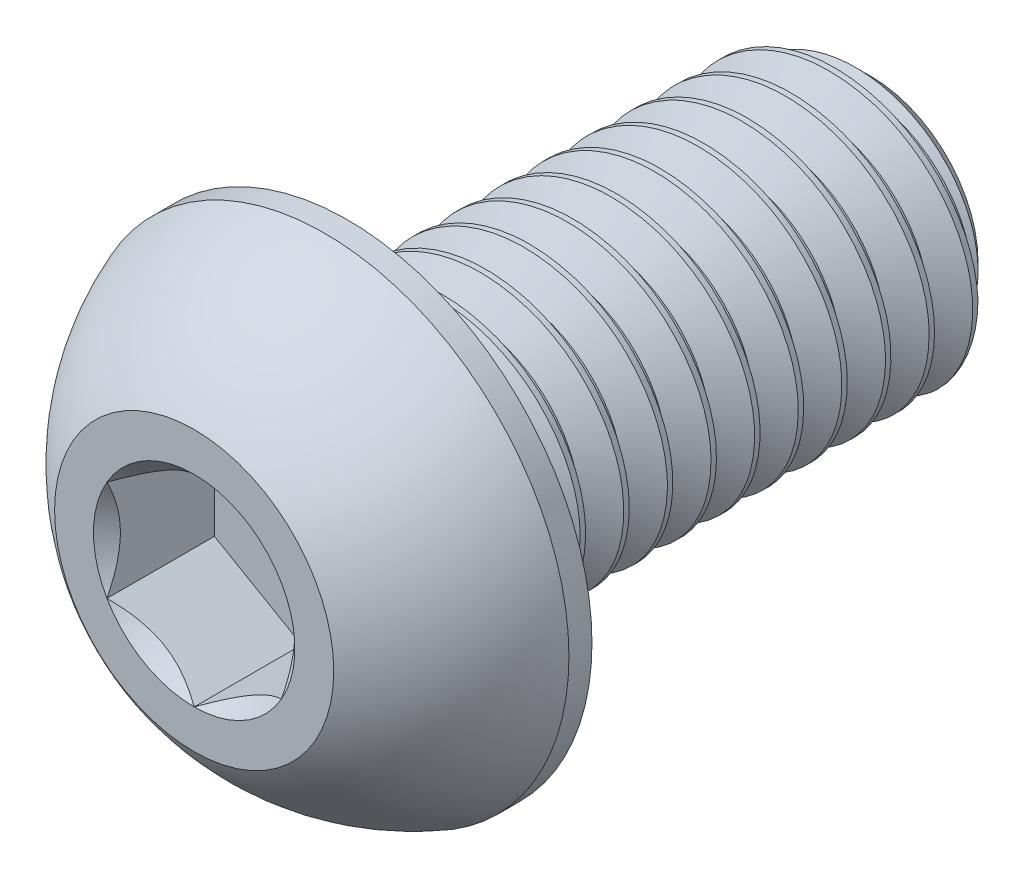
from build123d import *

# Parameters (mm, degrees)
CUT_EXTRUDE2_DEPTH = 3.08
CUT_SWEEP2_PITCH   = 1.25
CUT_SWEEP2_TO      = 15


with BuildPart() as part:
    # Sketch10 → Revolve3 (revolve)
    with BuildSketch(Plane(origin=(0, 0, 0), x_dir=(0, 0, -1), z_dir=(1, 0, 0)), mode=Mode.PRIVATE) as revolve3_sk:
        Polygon((18.4625, 4), (19.4, 3.0625), (19.4, 0), (4.4, 0), (4.4, 4), align=None)
    revolve(revolve3_sk.sketch.rotate(Axis((0, 0, 0), (0, 0, -1)), 90), axis=Axis((0, 0, 0), (0, 0, -1)))

    # Sketch7 → Revolve2 (revolve)
    with BuildSketch(Plane(origin=(0, 0, 0), x_dir=(0, 0, -1), z_dir=(1, 0, 0)), mode=Mode.PRIVATE) as revolve2_sk:
        with BuildLine():
            Line((3.74, 7), (4.4, 7))
            Line((4.4, 7), (4.4, 0))
            Line((4.4, 0), (0, 0))
            Line((0, 0), (0, 4))
            ThreePointArc((0, 4), (1.621972026, 5.809208208), (3.74, 7))
        make_face()
    revolve(revolve2_sk.sketch.rotate(Axis((0, 0, 0), (0, 0, -1)), 180), axis=Axis((0, 0, 0), (0, 0, -1)))

    # Sketch5 → Cut-Extrude2 (cut)
    with BuildSketch(Plane.XY):
        Polygon((2.5, -1.443375673), (2.5, 1.443375673), (0, 2.886751346), (-2.5, 1.443375673), (-2.5, -1.443375673), (0, -2.886751346), align=None)
    extrude(amount=-CUT_EXTRUDE2_DEPTH, mode=Mode.SUBTRACT)

    # Cut-Extrude3 cone 1 section (through the dimple's axis) → Cut-Extrude3 (revolve, cut)
    with BuildSketch(Plane(origin=(0, 0, 0), x_dir=(0, -1, 0), z_dir=(1, 0, 0))):
        Polygon((0, 0), (2.886751346, 0), (0, 2.886751346), align=None)
    revolve(axis=Axis((0, 0, 0), (0, 0, -1)), mode=Mode.SUBTRACT)


with BuildPart() as body_2:
    # Split1: read off the stored shape, not the designer's step
    # Split1: the piece on the far side of the plane
    add(part.part)
    split(bisect_by=Plane.XY.offset(-4.4), keep=Keep.BOTTOM)

    # Cut-Sweep2: arcs per turn and ends read off the stored shape
    # Cut-Sweep2: the profile of Sketch12 screwed along a right-hand helix through 16.5 turns, 8 arcs to a turn; built about Z, then put on its axis
    cut_sweep2_z = Axis((0, 0, 0), (0, 0, 1))
    cut_sweep2_corners = [(3.188101184, 0, -0.46875), (3.188101184, 0, -0.625), (4.067658235, 0, -1.1328125), (4.067658235, 0, 0.0390625)]
    with BuildLine(mode=Mode.PRIVATE) as cut_sweep2_profile:
        Line(cut_sweep2_corners[0], cut_sweep2_corners[1])
        Line(cut_sweep2_corners[1], cut_sweep2_corners[2])
        Line(cut_sweep2_corners[2], cut_sweep2_corners[3])
        Line(cut_sweep2_corners[3], cut_sweep2_corners[0])
    cut_sweep2_cap = Face(cut_sweep2_profile.wire())
    cut_sweep2_turn_angles = [0, 22.5, 45, 67.5, 90, 112.5, 135, 157.5, 180, 202.5, 225, 247.5, 270, 292.5, 315, 337.5, 360]
    cut_sweep2_turn_weights = [1, 0.9238795325112867, 1, 0.9238795325112867, 1, 0.9238795325112867, 1, 0.9238795325112867, 1, 0.9238795325112867, 1, 0.9238795325112867, 1, 0.9238795325112867, 1, 0.9238795325112867, 1]
    cut_sweep2_turn_rails = [Edge.make_bspline([Vector(p[0], p[1], 0).rotate(cut_sweep2_z, cut_sweep2_turn_angles[k]) / cut_sweep2_turn_weights[k] + Vector(0, 0, p[2] + CUT_SWEEP2_PITCH * cut_sweep2_turn_angles[k] / 360) for k in range(17)], [0, 0, 0, 1, 1, 2, 2, 3, 3, 4, 4, 5, 5, 6, 6, 7, 7, 8, 8, 8], 2, cut_sweep2_turn_weights) for p in cut_sweep2_corners]
    cut_sweep2_turn_sides = [Face.make_surface_from_curves(cut_sweep2_turn_rails[p[0]], cut_sweep2_turn_rails[p[1]]) for p in [(0, 1), (1, 2), (2, 3), (3, 0)]]
    cut_sweep2_last_angles = [5760, 5782.5, 5805, 5827.5, 5850, 5872.5, 5895, 5917.5, 5940]
    cut_sweep2_last_weights = [1, 0.9238795325112867, 1, 0.9238795325112867, 1, 0.9238795325112867, 1, 0.9238795325112867, 1]
    cut_sweep2_last_rails = [Edge.make_bspline([Vector(p[0], p[1], 0).rotate(cut_sweep2_z, cut_sweep2_last_angles[k]) / cut_sweep2_last_weights[k] + Vector(0, 0, p[2] + CUT_SWEEP2_PITCH * cut_sweep2_last_angles[k] / 360) for k in range(9)], [0, 0, 0, 1, 1, 2, 2, 3, 3, 4, 4, 4], 2, cut_sweep2_last_weights) for p in cut_sweep2_corners]
    cut_sweep2_last_sides = [Face.make_surface_from_curves(cut_sweep2_last_rails[p[0]], cut_sweep2_last_rails[p[1]]) for p in [(0, 1), (1, 2), (2, 3), (3, 0)]]
    cut_sweep2 = Plane(origin=(0, 0, -19.4), x_dir=(0, 1, 0), z_dir=(0, 0, 1)) * split(Solid(Shell([*[p.moved(Location((0, 0, CUT_SWEEP2_PITCH * i))) for i in range(16) for p in cut_sweep2_turn_sides], *cut_sweep2_last_sides, cut_sweep2_cap, cut_sweep2_cap.rotate(cut_sweep2_z, 5940).moved(Location((0, 0, CUT_SWEEP2_PITCH * 5940 / 360)))])), bisect_by=Plane.XY.offset(CUT_SWEEP2_TO), keep=Keep.BOTTOM, mode=Mode.PRIVATE)
    add(cut_sweep2, mode=Mode.SUBTRACT)


with BuildPart() as part_1:
    add(part.part)

    # Split1
    split(bisect_by=Plane.XY.offset(-4.4), keep=Keep.TOP)

    add(body_2.part)  # Boss-Extrude1 merges body 2
    # Boss-Extrude1: read off the stored shape, not the designer's step
    # Boss-Extrude1 outline → Boss-Extrude1 (revolve)
    with BuildSketch(Plane.XZ):
        Polygon((3.188094592, -4.4), (3.188094592, -5.211905408), (4, -4.4), align=None)
    revolve(axis=Axis((0, 0, 0), (0, 0, 1)))


solid = part_1.part
